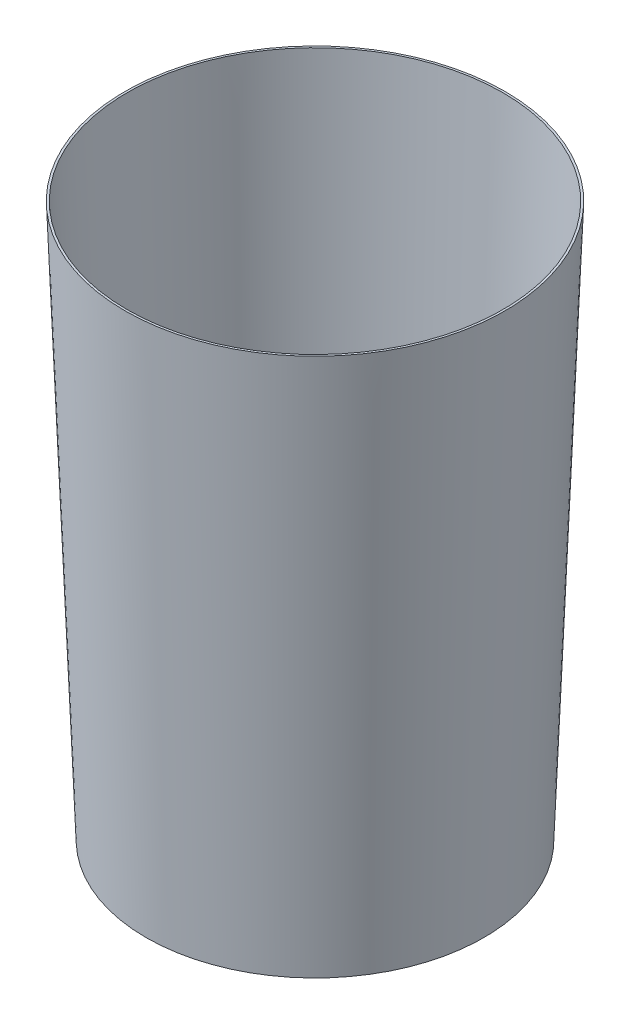
from build123d import *

# Parameters (mm, degrees)
SHELL1_T = -0.5


# Read off the part's stored shape, not the designer's step: Boundary1
with BuildPart() as part:
    # Boundary1 outline → Boundary1 (revolve)
    with BuildSketch(Plane.XY):
        Polygon((0, 63), (40, 63), (45, 194.05), (0, 194.05), align=None)
    revolve(axis=Axis((0, 0, 0), (0, 1, 0)))

    # Shell1
    shell1_openings = [part.faces().sort_by_distance(p)[0] for p in [
        (0, 194.05, 0),
    ]]
    offset(amount=SHELL1_T, openings=shell1_openings, kind=Kind.INTERSECTION)


solid = part.part
